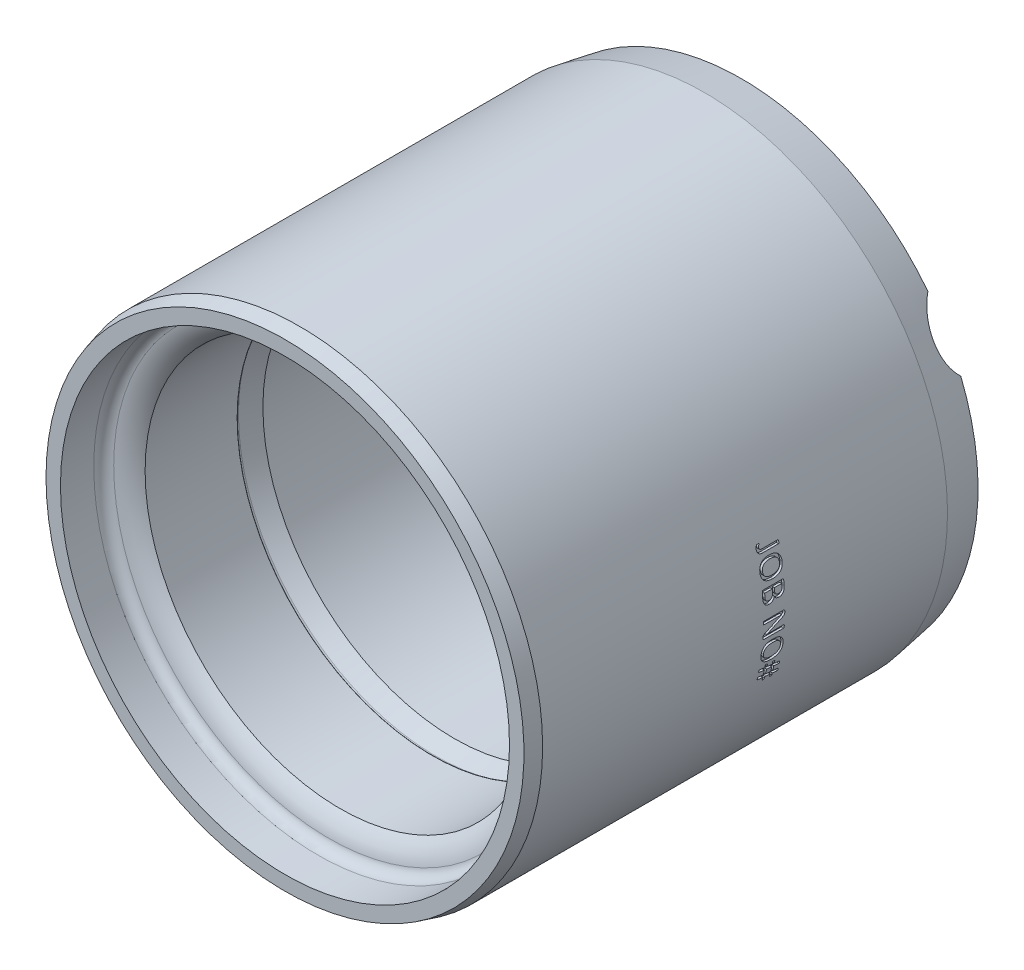
from build123d import *

# Parameters (mm, degrees)
CUT_EXTRUDE3_REACH      = 79.602
CUT_EXTRUDE3_END_RADIUS = 33
CIRPATTERN3_COUNT       = 3
CUT_EXTRUDE4_DEPTH      = 11
SKETCH11_R              = 32.7
SKETCH11_R_2            = 31.5
BOSS_EXTRUDE1_DEPTH     = 45


with BuildPart() as part:
    # Sketch1 → Revolve1 (revolve)
    with BuildSketch(Plane(origin=(0, 0, 0), x_dir=(0, 0, -1), z_dir=(1, 0, 0))):
        with BuildLine():
            Line((0, 32.15), (0, 27))
            Line((0, 27), (-0.741586391, 24.23236191))
            ThreePointArc((-0.741586391, 24.23236191), (-1.455915186, 23.163293319), (-2.673438044, 22.75))
            Line((-2.673438044, 22.75), (-4.5, 22.75))
            ThreePointArc((-4.5, 22.75), (-4.853553391, 22.896446609), (-5, 23.25))
            Line((-5, 23.25), (-5, 25.7))
            ThreePointArc((-5, 25.7), (-5.234314575, 26.265685425), (-5.8, 26.5))
            Line((-5.8, 26.5), (-6.633974596, 26.5))
            Line((-6.633974596, 26.5), (-7.5, 26))
            Line((-7.5, 26), (-39, 26))
            Line((-39, 26), (-41.469276208, 26.853868593))
            ThreePointArc((-41.469276208, 26.853868593), (-41.832067321, 26.801631143), (-42, 26.475832496))
            Line((-42, 26.475832496), (-42, 26.5))
            Line((-42, 26.5), (-54.5, 26.5))
            ThreePointArc((-54.5, 26.5), (-55.47302218, 27.761195369), (-56, 29.264418671))
            ThreePointArc((-56, 29.264418671), (-56.513865022, 30.15035386), (-57.476510334, 30.5))
            Line((-57.476510334, 30.5), (-62, 30.5))
            Line((-62, 30.5), (-62, 32.464101615))
            Line((-62, 32.464101615), (-60, 33))
            Line((-60, 33), (-5, 33))
            Line((-5, 33), (0, 32.15))
        make_face()
    revolve(axis=Axis((0, 0, 0), (0, 0, 1)))

    # Cut-Extrude3: up to this cylinder (the profile starts inside it)
    cut_extrude3_end = Plane(origin=(0, 0, 0.812657), z_dir=(0, 0, -1)) * Cylinder(CUT_EXTRUDE3_END_RADIUS, 226.204, mode=Mode.PRIVATE)
    # Sketch9 → Cut-Extrude3 (cut, up to the surface)
    with BuildSketch(Plane(origin=(0, 0, 0), x_dir=(1, 0, 0), z_dir=(0, 1, 0)), mode=Mode.PRIVATE) as cut_extrude3_sk1:
        with BuildLine():
            Line((-4.472135955, 0), (4.472135955, 0))
            ThreePointArc((4.472135955, 0), (0, -2), (-4.472135955, 0))
        make_face()
    cut_extrude3_tool1 = extrude(cut_extrude3_sk1.sketch, amount=-CUT_EXTRUDE3_REACH, mode=Mode.PRIVATE) & cut_extrude3_end
    cut_extrude3 = cut_extrude3_tool1.solids().sort_by_distance((0, 0, 0.812657))[0]
    add(cut_extrude3, mode=Mode.SUBTRACT)

    # CirPattern3: Cut-Extrude3 ×3 about axis
    cirpattern3_axis = Axis((0, 0, 0), (0, 0, -1))
    for i in range(1, CIRPATTERN3_COUNT):
        add(cut_extrude3.rotate(cirpattern3_axis, i * 360 / CIRPATTERN3_COUNT), mode=Mode.SUBTRACT)

    # Sketch10 → Cut-Extrude4 (cut)
    # profile 1 of 6: a face of its own
    with BuildSketch(Plane(origin=(40, 0, 0), x_dir=(0, 0, -1), z_dir=(1, 0, 0))):
        with BuildLine():
            add(Edge.make_bspline(
                [(-29.283076335, 7.126240809), (-29.311171742, 7.126634763), (-29.366314526, 7.127407976), (-29.447428503, 7.133226249), (-29.524776116, 7.144336515), (-29.598565322, 7.157616533), (-29.667559345, 7.177002797), (-29.731759804, 7.201785507), (-29.790829117, 7.232321092), (-29.844178879, 7.269579357), (-29.892294055, 7.312708578), (-29.934256155, 7.362396737), (-29.970999336, 7.417891533), (-30.00109765, 7.480214501), (-30.025480711, 7.549412271), (-30.041455219, 7.626567475), (-30.052679321, 7.710849177), (-30.053647129, 7.769763359), (-30.0541495, 7.800344669)],
                knots=[0, 0, 0, 0, 1.143010935, 2.243384585, 3.305342186, 4.320942577, 5.291362086, 6.215949829, 7.116473707, 7.989450952, 8.856330162, 9.737699133, 10.628119925, 11.556923371, 12.546436305, 13.604864187, 14.756727331, 16, 16, 16, 16], degree=3))
            add(Edge.make_bspline(
                [(-30.0541495, 7.800344669), (-30.053575791, 7.822237648), (-30.052433068, 7.865844391), (-30.041155349, 7.929888757), (-30.024628248, 7.990642574), (-30.004011481, 8.04681276), (-29.9803308, 8.096796264), (-29.954557497, 8.138421899), (-29.932365165, 8.170034499), (-29.91546094, 8.192399262), (-29.90016332, 8.204641592), (-29.887041835, 8.214618767), (-29.872685416, 8.223130441), (-29.855063576, 8.228804553), (-29.834473964, 8.234702567), (-29.808940381, 8.236449427), (-29.77889457, 8.238864524), (-29.757009792, 8.238983109), (-29.745185231, 8.239047181)],
                knots=[0, 0, 0, 0, 1.734681065, 3.455162098, 5.140500421, 6.72333302, 8.193997046, 9.518891422, 10.597818724, 11.263266488, 11.727288577, 12.144500434, 12.57207019, 13.041781908, 13.607748736, 14.265639715, 15.062908056, 16, 16, 16, 16], degree=3))
            add(Edge.make_bspline(
                [(-29.745185231, 8.239047181), (-29.730682536, 8.239025176), (-29.704322339, 8.238985178), (-29.668638696, 8.236221942), (-29.639713478, 8.232506118), (-29.618129836, 8.224081636), (-29.601257455, 8.215022121), (-29.591063188, 8.202188568), (-29.584146477, 8.18776799), (-29.583625337, 8.177168261), (-29.583346804, 8.171503045)],
                knots=[0, 0, 0, 0, 1.778709272, 3.232994018, 4.398029426, 5.33313715, 6.069868627, 6.71096954, 7.311054526, 8, 8, 8, 8], degree=3))
            add(Edge.make_bspline(
                [(-29.583346804, 8.171503045), (-29.584451164, 8.164412697), (-29.587099048, 8.147412425), (-29.605265857, 8.123397415), (-29.625271695, 8.092835666), (-29.648926108, 8.056949493), (-29.671343605, 8.014429874), (-29.693854643, 7.966479671), (-29.708998307, 7.909095364), (-29.710793976, 7.867766828), (-29.711747539, 7.84581993)],
                knots=[0, 0, 0, 0, 0.477542415, 1.144986375, 1.978504432, 2.958097559, 4.033814973, 5.217747953, 6.52252689, 8, 8, 8, 8], degree=3))
            add(Edge.make_bspline(
                [(-29.711747539, 7.84581993), (-29.710908787, 7.822145988), (-29.709348034, 7.778093421), (-29.696454437, 7.716042379), (-29.667299504, 7.663698115), (-29.630300064, 7.629754872), (-29.593388834, 7.607700508), (-29.559648678, 7.594454967), (-29.521992663, 7.581088881), (-29.478614412, 7.571571278), (-29.429334942, 7.563263176), (-29.373430799, 7.558493183), (-29.310762236, 7.555015731), (-29.266809532, 7.554510056), (-29.243619859, 7.55424326)],
                knots=[0, 0, 0, 0, 1.336192069, 2.486391609, 3.539509806, 4.660733814, 5.275522948, 5.957650545, 6.701467244, 7.52828585, 8.45881682, 9.520165551, 10.691626503, 12, 12, 12, 12], degree=3))
            Line((-29.243619859, 7.55424326), (-27.170482987, 7.55424326))
            add(Edge.make_bspline(
                [(-27.170482987, 7.55424326), (-27.165276473, 7.553670697), (-27.154782866, 7.55251671), (-27.139809302, 7.544590129), (-27.127055673, 7.529794879), (-27.117750001, 7.50763039), (-27.109614858, 7.478244967), (-27.104989377, 7.440444418), (-27.101604371, 7.393584033), (-27.101171345, 7.359200205), (-27.100932588, 7.340242034)],
                knots=[0, 0, 0, 0, 0.51207449, 1.032074136, 1.622280887, 2.397485073, 3.376723707, 4.617546833, 6.135020758, 8, 8, 8, 8], degree=3))
            add(Edge.make_bspline(
                [(-27.100932588, 7.340242034), (-27.101196411, 7.321734218), (-27.101683236, 7.287582174), (-27.104895638, 7.240898511), (-27.109768936, 7.202990133), (-27.117248238, 7.173696979), (-27.127868373, 7.152330524), (-27.139498534, 7.136716254), (-27.154634422, 7.12786017), (-27.165262856, 7.126774187), (-27.170482987, 7.126240809)],
                knots=[0, 0, 0, 0, 1.825144692, 3.367897259, 4.611461284, 5.592862992, 6.330205755, 6.955088943, 7.486794371, 8, 8, 8, 8], degree=3))
            Line((-27.170482987, 7.126240809), (-29.283076335, 7.126240809))
        make_face()
    # profile 2 of 6: a face of its own
    with BuildSketch(Plane(origin=(40, 0, 0), x_dir=(0, 0, -1), z_dir=(1, 0, 0))):
        with BuildLine():
            add(Edge.make_bspline(
                [(-28.52270323, 3.959022672), (-28.580026634, 3.960070836), (-28.692210562, 3.962122132), (-28.856058522, 3.97750824), (-29.011466357, 4.003440774), (-29.15774619, 4.040060251), (-29.294804362, 4.086457834), (-29.421144281, 4.144139458), (-29.53695897, 4.212086899), (-29.642767126, 4.289591231), (-29.737034579, 4.378575686), (-29.819797547, 4.477979738), (-29.890303909, 4.588350071), (-29.950302081, 4.70843402), (-29.997168619, 4.839760469), (-30.03016229, 4.981548383), (-30.050634265, 5.133649746), (-30.05295436, 5.238504439), (-30.0541495, 5.292517808)],
                knots=[0, 0, 0, 0, 1.191349841, 2.33151377, 3.416966321, 4.463182302, 5.462485, 6.420369482, 7.344547342, 8.24900213, 9.140535385, 10.032176993, 10.930546801, 11.856778172, 12.816733517, 13.821446026, 14.877770412, 16, 16, 16, 16], degree=3))
            add(Edge.make_bspline(
                [(-30.0541495, 5.292517808), (-30.05315048, 5.345636776), (-30.05121289, 5.448660566), (-30.031891962, 5.597219162), (-30.002481561, 5.735027091), (-29.95959924, 5.861634742), (-29.904200925, 5.977291115), (-29.838965379, 6.083268029), (-29.760953861, 6.177527053), (-29.672725913, 6.261993829), (-29.572839046, 6.3358453), (-29.461995999, 6.399575827), (-29.339692552, 6.452226585), (-29.206784637, 6.495808287), (-29.062740326, 6.528639935), (-28.908325136, 6.552476625), (-28.743689726, 6.567518409), (-28.630406089, 6.569050368), (-28.572191014, 6.569837623)],
                knots=[0, 0, 0, 0, 1.137667702, 2.206496874, 3.204370452, 4.15299996, 5.06318426, 5.947235594, 6.812662801, 7.677575739, 8.558407935, 9.46786496, 10.411212271, 11.406659154, 12.461056006, 13.573073946, 14.752832389, 16, 16, 16, 16], degree=3))
            add(Edge.make_bspline(
                [(-28.572191014, 6.569837623), (-28.515979412, 6.56880696), (-28.406236689, 6.566794781), (-28.24553296, 6.551185982), (-28.092757901, 6.525477125), (-27.948130858, 6.488552671), (-27.812266569, 6.442564769), (-27.686820308, 6.384583288), (-27.571973152, 6.316316269), (-27.467636715, 6.237654947), (-27.373815051, 6.149002102), (-27.291717744, 6.049199323), (-27.221145195, 5.938677327), (-27.162286662, 5.817710596), (-27.115155847, 5.686657926), (-27.081976036, 5.544881396), (-27.061703043, 5.392750677), (-27.059344654, 5.287678826), (-27.058132343, 5.233667471)],
                knots=[0, 0, 0, 0, 1.175343485, 2.294640089, 3.372947809, 4.412007972, 5.413017894, 6.368293769, 7.296489874, 8.201798854, 9.095401933, 9.989527717, 10.897317773, 11.831337077, 12.797167058, 13.803492583, 14.870902707, 16, 16, 16, 16], degree=3))
            add(Edge.make_bspline(
                [(-27.058132343, 5.233667471), (-27.059240115, 5.181677539), (-27.061391483, 5.080709529), (-27.079344438, 4.934374647), (-27.110253457, 4.798499781), (-27.152097822, 4.672782299), (-27.205856415, 4.557357764), (-27.271308099, 4.452150905), (-27.347648581, 4.356493331), (-27.436166741, 4.271779797), (-27.535407145, 4.197273775), (-27.644952847, 4.131787904), (-27.766210738, 4.077980506), (-27.897905924, 4.033875294), (-28.040063174, 3.999998626), (-28.192156775, 3.976538933), (-28.354089336, 3.961282921), (-28.465376781, 3.959791126), (-28.52270323, 3.959022672)],
                knots=[0, 0, 0, 0, 1.124153723, 2.183183562, 3.18197749, 4.133311137, 5.04347791, 5.929104716, 6.80702139, 7.683308329, 8.57135945, 9.485819096, 10.43743367, 11.434504052, 12.485735786, 13.593802196, 14.76051808, 16, 16, 16, 16], degree=3))
        make_face()
        with BuildLine():
            add(Edge.make_bspline(
                [(-28.551459645, 4.387025123), (-28.511321438, 4.387526823), (-28.432300401, 4.388514532), (-28.316005679, 4.396656988), (-28.203975631, 4.410075909), (-28.096563466, 4.428162686), (-27.994801637, 4.453532057), (-27.899293886, 4.48543342), (-27.810694715, 4.524845965), (-27.729067985, 4.571785547), (-27.655091154, 4.626624164), (-27.589400597, 4.690046634), (-27.533072819, 4.762268138), (-27.484954204, 4.842683126), (-27.446518003, 4.932511357), (-27.419387718, 5.032156022), (-27.403280476, 5.141746307), (-27.401475058, 5.218005843), (-27.400534304, 5.257742609)],
                knots=[0, 0, 0, 0, 1.16906547, 2.301566814, 3.393680675, 4.454778471, 5.47212095, 6.44540886, 7.384232912, 8.291912384, 9.18278391, 10.059847445, 10.943138162, 11.842909913, 12.782474672, 13.779662713, 14.843042763, 16, 16, 16, 16], degree=3))
            add(Edge.make_bspline(
                [(-27.400534304, 5.257742609), (-27.401643046, 5.297489766), (-27.403772479, 5.373827493), (-27.4212743, 5.483510898), (-27.450439871, 5.583247702), (-27.491733192, 5.673302196), (-27.543222478, 5.753638078), (-27.601801681, 5.826923913), (-27.668748724, 5.891881605), (-27.743799079, 5.948117316), (-27.825277206, 5.997356087), (-27.913639278, 6.038652475), (-28.008671501, 6.072206872), (-28.109588288, 6.09760356), (-28.214791761, 6.117629698), (-28.323358453, 6.13132126), (-28.434491038, 6.140530885), (-28.509532081, 6.141397372), (-28.547447122, 6.141835172)],
                knots=[0, 0, 0, 0, 1.161227874, 2.230234876, 3.23623063, 4.189578402, 5.115044591, 6.018624442, 6.926329179, 7.833285333, 8.754014825, 9.704195839, 10.678922322, 11.695036858, 12.742866953, 13.807197742, 14.89207049, 16, 16, 16, 16], degree=3))
            add(Edge.make_bspline(
                [(-28.547447122, 6.141835172), (-28.588925225, 6.14135953), (-28.670400777, 6.140425227), (-28.789973621, 6.131968045), (-28.904795576, 6.119764356), (-29.014072376, 6.101230517), (-29.117397509, 6.07659885), (-29.214125974, 6.045898477), (-29.302871734, 6.00570867), (-29.38484411, 5.959899127), (-29.459359085, 5.906522165), (-29.524142535, 5.843231675), (-29.580758701, 5.771896754), (-29.628537728, 5.691782919), (-29.666715255, 5.601968898), (-29.692745061, 5.501714096), (-29.709081905, 5.390913529), (-29.710833033, 5.313534324), (-29.711747539, 5.273123947)],
                knots=[0, 0, 0, 0, 1.197112985, 2.35149234, 3.458580793, 4.529125571, 5.548253836, 6.522942298, 7.453293408, 8.355171445, 9.230372149, 10.090421365, 10.960688115, 11.852339373, 12.774981647, 13.767684789, 14.834199703, 16, 16, 16, 16], degree=3))
            add(Edge.make_bspline(
                [(-29.711747539, 5.273123947), (-29.710627464, 5.233155124), (-29.70846967, 5.156156258), (-29.691001169, 5.045372571), (-29.6618458, 4.944300374), (-29.62062006, 4.853134771), (-29.569393331, 4.771492378), (-29.508999352, 4.699078699), (-29.442126167, 4.633200285), (-29.365779233, 4.577170459), (-29.282362712, 4.529028906), (-29.192774493, 4.488245177), (-29.09677793, 4.455510499), (-28.995421907, 4.429718256), (-28.889214095, 4.410522909), (-28.779291339, 4.397681959), (-28.666423357, 4.38828838), (-28.59004451, 4.387449105), (-28.551459645, 4.387025123)],
                knots=[0, 0, 0, 0, 1.156376524, 2.227728346, 3.236314579, 4.192133592, 5.114055089, 6.016996904, 6.915872434, 7.824329852, 8.74947427, 9.699417313, 10.668622314, 11.681101484, 12.723901887, 13.789878023, 14.883496378, 16, 16, 16, 16], degree=3))
        make_face(mode=Mode.SUBTRACT)
    # profile 3 of 6: a face of its own
    with BuildSketch(Plane(origin=(40, 0, 0), x_dir=(0, 0, -1), z_dir=(1, 0, 0))):
        with BuildLine():
            add(Edge.make_bspline(
                [(-29.190119552, 1.391007966), (-29.212209726, 1.39130739), (-29.255604876, 1.391895597), (-29.319461943, 1.399094029), (-29.380851056, 1.409265492), (-29.457661506, 1.429844593), (-29.547344429, 1.464870394), (-29.645604947, 1.521013861), (-29.731004796, 1.592662162), (-29.806412895, 1.675524095), (-29.868800475, 1.771591861), (-29.921693347, 1.877734568), (-29.960414787, 1.994210392), (-29.985767455, 2.096817654), (-29.998668231, 2.184178869), (-30.005899707, 2.255135532), (-30.010825513, 2.330761138), (-30.011171314, 2.382761709), (-30.011349255, 2.409520048)],
                knots=[0, 0, 0, 0, 0.717545398, 1.409585587, 2.086093876, 2.738028078, 3.990528374, 5.204535299, 6.398335882, 7.598625512, 8.832337766, 10.108869732, 11.442271239, 12.812862199, 13.538264167, 14.310316416, 15.130526328, 16, 16, 16, 16], degree=3))
            Line((-30.011349255, 2.409520048), (-30.011349255, 3.172568168))
            add(Edge.make_bspline(
                [(-30.011349255, 3.172568168), (-30.009573627, 3.189799195), (-30.005932504, 3.225133337), (-29.983277118, 3.265463495), (-29.956184091, 3.292637137), (-29.927759402, 3.307241087), (-29.8930575, 3.316040807), (-29.867852529, 3.316675181), (-29.854192105, 3.317018995)],
                knots=[0, 0, 0, 0, 1.283024327, 2.630984544, 3.348831971, 4.123093912, 4.982766836, 6, 6, 6, 6], degree=3))
            Line((-29.854192105, 3.317018995), (-27.258089738, 3.317018995))
            add(Edge.make_bspline(
                [(-27.258089738, 3.317018995), (-27.24442586, 3.316678773), (-27.219214515, 3.316051027), (-27.184553447, 3.307208846), (-27.155855221, 3.292670194), (-27.129155639, 3.264559429), (-27.106412367, 3.224007424), (-27.102722197, 3.188466718), (-27.100932588, 3.17123066)],
                knots=[0, 0, 0, 0, 1.012797402, 1.868721623, 2.639607306, 3.365943559, 4.722570448, 6, 6, 6, 6], degree=3))
            Line((-27.100932588, 3.17123066), (-27.100932588, 2.502476831))
            add(Edge.make_bspline(
                [(-27.100932588, 2.502476831), (-27.101571333, 2.460328167), (-27.102786354, 2.380152972), (-27.111914264, 2.265718951), (-27.127665183, 2.163299348), (-27.14964955, 2.071704026), (-27.178123928, 1.989932212), (-27.211506436, 1.915586371), (-27.251124674, 1.848249436), (-27.296603499, 1.78780054), (-27.34772571, 1.73477355), (-27.403977092, 1.688250916), (-27.466424124, 1.64995218), (-27.533669432, 1.617283565), (-27.606379399, 1.592907889), (-27.683356393, 1.574812877), (-27.765134744, 1.563832971), (-27.821145882, 1.562760315), (-27.849936878, 1.562208946)],
                knots=[0, 0, 0, 0, 1.474059348, 2.803955984, 4.011411403, 5.094932464, 6.093527403, 7.035585468, 7.94082247, 8.820276359, 9.674947962, 10.511504882, 11.366034228, 12.2308516, 13.120920121, 14.041900977, 14.993492692, 16, 16, 16, 16], degree=3))
            add(Edge.make_bspline(
                [(-27.849936878, 1.562208946), (-27.884349719, 1.563288274), (-27.952144807, 1.565414606), (-28.051023107, 1.584530745), (-28.143747136, 1.616236743), (-28.230057628, 1.658760356), (-28.308123873, 1.71436762), (-28.376630493, 1.78259037), (-28.435732373, 1.862446758), (-28.464584027, 1.922789357), (-28.479234231, 1.953429936)],
                knots=[0, 0, 0, 0, 1.048458382, 2.065517578, 3.056350007, 4.028996594, 4.98895111, 5.964561463, 6.966451261, 8, 8, 8, 8], degree=3))
            add(Edge.make_bspline(
                [(-28.479234231, 1.953429936), (-28.483322146, 1.934159624), (-28.491451037, 1.89584026), (-28.510212937, 1.840197883), (-28.53177086, 1.78564136), (-28.559507357, 1.733809996), (-28.590753853, 1.684200385), (-28.626350359, 1.637855668), (-28.666183049, 1.594895614), (-28.709386926, 1.55488343), (-28.756576302, 1.518217343), (-28.808151406, 1.486472625), (-28.863308775, 1.458100299), (-28.922147852, 1.434190975), (-28.984391098, 1.414342592), (-29.050413044, 1.4016267), (-29.119187519, 1.392239547), (-29.166233306, 1.391422699), (-29.190119552, 1.391007966)],
                knots=[0, 0, 0, 0, 0.957116368, 1.903243099, 2.851354886, 3.806566421, 4.756844616, 5.699985928, 6.643563201, 7.602458084, 8.560801368, 9.544377285, 10.543069153, 11.57372351, 12.629718687, 13.713934332, 14.839311029, 16, 16, 16, 16], degree=3))
        make_face()
        with BuildLine():
            add(Edge.make_bspline(
                [(-27.8800308, 1.990211397), (-27.844942847, 1.991359426), (-27.777655411, 1.993560977), (-27.69633853, 2.010891538), (-27.638108193, 2.03303823), (-27.597541953, 2.051810454), (-27.561516547, 2.076532959), (-27.527986858, 2.103960281), (-27.498713891, 2.136459483), (-27.472197774, 2.172724208), (-27.450188781, 2.213976386), (-27.431861833, 2.260140574), (-27.418012259, 2.312699202), (-27.407264922, 2.372132838), (-27.401586668, 2.439504604), (-27.400897671, 2.486863151), (-27.400534304, 2.511839384)],
                knots=[0, 0, 0, 0, 1.801750381, 3.455179152, 4.238008704, 5.00124002, 5.744532905, 6.476265321, 7.222024699, 7.984912217, 8.779219113, 9.617161995, 10.53124474, 11.566894225, 12.716814158, 14, 14, 14, 14], degree=3))
            Line((-27.400534304, 2.511839384), (-27.400534304, 2.889016544))
            Line((-27.400534304, 2.889016544), (-28.384939941, 2.889016544))
            Line((-28.384939941, 2.889016544), (-28.384939941, 2.473720416))
            add(Edge.make_bspline(
                [(-28.384939941, 2.473720416), (-28.384415829, 2.451185435), (-28.383416433, 2.40821488), (-28.376245582, 2.347012249), (-28.363942679, 2.292548483), (-28.345669255, 2.244656671), (-28.32203, 2.203078212), (-28.297060814, 2.164281547), (-28.267069023, 2.130200518), (-28.223434413, 2.088739226), (-28.15868157, 2.047071707), (-28.071105797, 2.013517031), (-27.976940366, 1.994301916), (-27.912437522, 1.991579273), (-27.8800308, 1.990211397)],
                knots=[0, 0, 0, 0, 1.020345009, 1.945632491, 2.785481367, 3.54283894, 4.25662876, 4.948158123, 5.628096787, 6.306535143, 7.67004186, 9.079699953, 10.532818958, 12, 12, 12, 12], degree=3))
        make_face(mode=Mode.SUBTRACT)
        with BuildLine():
            add(Edge.make_bspline(
                [(-29.218207213, 1.819010417), (-29.197004263, 1.819524005), (-29.15602536, 1.820516615), (-29.096529774, 1.828162806), (-29.04080739, 1.839759806), (-28.98910893, 1.857379825), (-28.941197572, 1.879351771), (-28.897609017, 1.906604157), (-28.857025611, 1.936992768), (-28.82137946, 1.973252181), (-28.789119633, 2.0134386), (-28.760636418, 2.058570012), (-28.737730781, 2.108980577), (-28.717845607, 2.164115287), (-28.70245661, 2.225458989), (-28.6923418, 2.293777637), (-28.685318004, 2.369249354), (-28.684808759, 2.421985054), (-28.684541657, 2.449645278)],
                knots=[0, 0, 0, 0, 1.076338185, 2.080236849, 3.041624367, 3.96160127, 4.847880865, 5.711830604, 6.567658865, 7.41611888, 8.285907433, 9.181034578, 10.117918527, 11.091820069, 12.154318916, 13.323062166, 14.595928373, 16, 16, 16, 16], degree=3))
            Line((-28.684541657, 2.449645278), (-28.684541657, 2.889016544))
            Line((-28.684541657, 2.889016544), (-29.711747539, 2.889016544))
            Line((-29.711747539, 2.889016544), (-29.711747539, 2.356019742))
            add(Edge.make_bspline(
                [(-29.711747539, 2.356019742), (-29.71141251, 2.335713643), (-29.710762963, 2.29634464), (-29.704344509, 2.239419635), (-29.69561243, 2.186180499), (-29.676729679, 2.121727726), (-29.644086901, 2.047573222), (-29.597963614, 1.982387146), (-29.554790321, 1.936519154), (-29.517011042, 1.90715859), (-29.476720622, 1.880213208), (-29.432024565, 1.857967338), (-29.383716761, 1.840751607), (-29.331796386, 1.827822788), (-29.276142951, 1.82065422), (-29.237843467, 1.819567554), (-29.218207213, 1.819010417)],
                knots=[0, 0, 0, 0, 1.033364579, 2.003463763, 2.914043665, 3.776156701, 5.417129535, 7.013579487, 7.816270035, 8.615664099, 9.443554668, 10.281036217, 11.149846822, 12.049969344, 13.000213735, 14, 14, 14, 14], degree=3))
        make_face(mode=Mode.SUBTRACT)
    # profile 4 of 6: a face of its own
    with BuildSketch(Plane(origin=(40, 0, 0), x_dir=(0, 0, -1), z_dir=(1, 0, 0))):
        with BuildLine():
            add(Edge.make_bspline(
                [(-29.845498305, -2.461014093), (-29.859433167, -2.460390485), (-29.885678217, -2.459215975), (-29.921659496, -2.446607787), (-29.950861468, -2.427565993), (-29.974081296, -2.40356491), (-29.991665269, -2.375718138), (-30.003579494, -2.344779803), (-30.010201266, -2.312391152), (-30.010971608, -2.290509107), (-30.011349255, -2.279781805)],
                knots=[0, 0, 0, 0, 1.205195523, 2.269876715, 3.262688849, 4.206796125, 5.146133144, 6.101866096, 7.069471963, 8, 8, 8, 8], degree=3))
            Line((-30.011349255, -2.279781805), (-30.011349255, -2.143356024))
            add(Edge.make_bspline(
                [(-30.011349255, -2.143356024), (-30.010718408, -2.123039412), (-30.00953902, -2.085056926), (-30.000500295, -2.030612234), (-29.981847748, -1.981442396), (-29.952668799, -1.935431978), (-29.911822771, -1.891624264), (-29.859390526, -1.847729349), (-29.793091219, -1.80424187), (-29.742783032, -1.778174599), (-29.715760062, -1.764172603)],
                knots=[0, 0, 0, 0, 0.949295484, 1.774735033, 2.565947931, 3.389611136, 4.303976894, 5.353577399, 6.578477978, 8, 8, 8, 8], degree=3))
            Line((-29.715760062, -1.764172603), (-28.067950626, -0.921542777))
            add(Edge.make_bspline(
                [(-28.067950626, -0.921542777), (-28.024310963, -0.899369402), (-27.935519666, -0.854254417), (-27.800496995, -0.788106215), (-27.664460445, -0.723710406), (-27.573157088, -0.683281392), (-27.528266286, -0.663403799)],
                knots=[0, 0, 0, 0, 0.981709107, 1.997431203, 3.015403985, 4, 4, 4, 4], degree=3))
            Line((-27.528266286, -0.663403799), (-27.528266286, -0.658722522))
            add(Edge.make_bspline(
                [(-27.528266286, -0.658722522), (-27.582432896, -0.659986352), (-27.692093607, -0.662544985), (-27.857514925, -0.663636212), (-28.024258553, -0.663345871), (-28.135494711, -0.663384515), (-28.191001331, -0.663403799)],
                knots=[0, 0, 0, 0, 0.98097619, 1.98599371, 2.995014897, 4, 4, 4, 4], degree=3))
            Line((-28.191001331, -0.663403799), (-29.939792595, -0.663403799))
            add(Edge.make_bspline(
                [(-29.939792595, -0.663403799), (-29.944983477, -0.662798402), (-29.955643519, -0.661555152), (-29.971317119, -0.653816095), (-29.984319161, -0.638518923), (-29.994370437, -0.616147446), (-29.9995684, -0.586079881), (-30.007362048, -0.548927519), (-30.01067192, -0.501834799), (-30.011107793, -0.467233385), (-30.011349255, -0.448065066)],
                knots=[0, 0, 0, 0, 0.507629026, 1.042471493, 1.658265389, 2.426739807, 3.40789359, 4.62344465, 6.12947268, 8, 8, 8, 8], degree=3))
            add(Edge.make_bspline(
                [(-30.011349255, -0.448065066), (-30.011117231, -0.428893862), (-30.010698395, -0.394287242), (-30.007286217, -0.347225789), (-29.999904543, -0.310625481), (-29.994106064, -0.281628843), (-29.984423134, -0.260071342), (-29.970896238, -0.245804771), (-29.955847191, -0.237090738), (-29.945016236, -0.23595102), (-29.939792595, -0.235401348)],
                knots=[0, 0, 0, 0, 1.891572084, 3.414544002, 4.643770878, 5.571751689, 6.329019298, 6.93561505, 7.486659786, 8, 8, 8, 8], degree=3))
            Line((-29.939792595, -0.235401348), (-27.266783538, -0.235401348))
            add(Edge.make_bspline(
                [(-27.266783538, -0.235401348), (-27.252901027, -0.235973244), (-27.226724989, -0.237051577), (-27.19027244, -0.246860126), (-27.160238193, -0.264628399), (-27.138133505, -0.28965247), (-27.12186064, -0.317750865), (-27.109471932, -0.347143566), (-27.102717944, -0.37821728), (-27.10153635, -0.399216216), (-27.100932588, -0.409946098)],
                knots=[0, 0, 0, 0, 1.222480005, 2.305035548, 3.292617378, 4.252430297, 5.213047754, 6.147369849, 7.053356642, 8, 8, 8, 8], degree=3))
            Line((-27.100932588, -0.409946098), (-27.100932588, -0.613916016))
            add(Edge.make_bspline(
                [(-27.100932588, -0.613916016), (-27.101287197, -0.6360183), (-27.101938947, -0.676641051), (-27.110425214, -0.73273548), (-27.12548051, -0.780883845), (-27.148689142, -0.823128131), (-27.18113389, -0.861771875), (-27.222494029, -0.898727435), (-27.275130586, -0.934373466), (-27.314928857, -0.955601021), (-27.336333936, -0.967018038)],
                knots=[0, 0, 0, 0, 1.163684759, 2.138786855, 2.978191552, 3.808674946, 4.659829269, 5.624477827, 6.722350489, 8, 8, 8, 8], degree=3))
            Line((-27.336333936, -0.967018038), (-28.607634967, -1.613702991))
            add(Edge.make_bspline(
                [(-28.607634967, -1.613702991), (-28.645993698, -1.633063093), (-28.721821188, -1.671334118), (-28.833935251, -1.72865383), (-28.944660345, -1.782507842), (-29.052933795, -1.835470576), (-29.159589016, -1.886981749), (-29.264738335, -1.937946573), (-29.369348438, -1.988444787), (-29.43931094, -2.021261946), (-29.47433993, -2.037692919)],
                knots=[0, 0, 0, 0, 1.068742979, 2.112689677, 3.13185519, 4.131205534, 5.110747879, 6.077892953, 7.037634914, 8, 8, 8, 8], degree=3))
            Line((-29.47433993, -2.037692919), (-29.47433993, -2.03969918))
            add(Edge.make_bspline(
                [(-29.47433993, -2.03969918), (-29.414376714, -2.038467856), (-29.292005454, -2.035955003), (-29.107195852, -2.034362979), (-28.922397886, -2.032689262), (-28.800013543, -2.032905628), (-28.740048225, -2.033011642)],
                knots=[0, 0, 0, 0, 0.980070645, 2.000100891, 3.020098614, 4, 4, 4, 4], degree=3))
            Line((-28.740048225, -2.033011642), (-27.172489248, -2.033011642))
            add(Edge.make_bspline(
                [(-27.172489248, -2.033011642), (-27.167253488, -2.03353173), (-27.156593231, -2.034590654), (-27.141737818, -2.043654983), (-27.128543108, -2.058567772), (-27.118348917, -2.080881977), (-27.109503332, -2.110025846), (-27.104960292, -2.147930922), (-27.101560306, -2.195673116), (-27.101157712, -2.231173924), (-27.100932588, -2.251025391)],
                knots=[0, 0, 0, 0, 0.502953326, 1.024036879, 1.634158783, 2.404945848, 3.372755644, 4.570153255, 6.082086269, 8, 8, 8, 8], degree=3))
            add(Edge.make_bspline(
                [(-27.100932588, -2.251025391), (-27.101180731, -2.268870893), (-27.101643391, -2.30214368), (-27.105124866, -2.347857638), (-27.109255602, -2.385885492), (-27.11873103, -2.41483842), (-27.129619642, -2.436290278), (-27.14218708, -2.451203811), (-27.157261206, -2.459173914), (-27.16751307, -2.460412764), (-27.172489248, -2.461014093)],
                knots=[0, 0, 0, 0, 1.781386541, 3.321379914, 4.580616967, 5.587268504, 6.344121305, 6.974526363, 7.50224285, 8, 8, 8, 8], degree=3))
            Line((-27.172489248, -2.461014093), (-29.845498305, -2.461014093))
        make_face()
    # profile 5 of 6: a face of its own
    with BuildSketch(Plane(origin=(40, 0, 0), x_dir=(0, 0, -1), z_dir=(1, 0, 0))):
        with BuildLine():
            add(Edge.make_bspline(
                [(-28.52270323, -5.671032475), (-28.580026634, -5.669984311), (-28.692210562, -5.667933015), (-28.856058522, -5.652546907), (-29.011466357, -5.626614373), (-29.15774619, -5.589994896), (-29.294804362, -5.543597313), (-29.421144281, -5.485915689), (-29.53695897, -5.417968248), (-29.642767126, -5.340463916), (-29.737034579, -5.251479461), (-29.819797547, -5.15207541), (-29.890303909, -5.041705076), (-29.950302081, -4.921621127), (-29.997168619, -4.790294678), (-30.03016229, -4.648506764), (-30.050634265, -4.496405401), (-30.05295436, -4.391550708), (-30.0541495, -4.337537339)],
                knots=[0, 0, 0, 0, 1.191349841, 2.33151377, 3.416966321, 4.463182302, 5.462485, 6.420369482, 7.344547342, 8.24900213, 9.140535385, 10.032176993, 10.930546801, 11.856778172, 12.816733517, 13.821446026, 14.877770412, 16, 16, 16, 16], degree=3))
            add(Edge.make_bspline(
                [(-30.0541495, -4.337537339), (-30.05315048, -4.284418371), (-30.05121289, -4.181394581), (-30.031891962, -4.032835985), (-30.002481561, -3.895028057), (-29.95959924, -3.768420405), (-29.904200925, -3.652764032), (-29.838965379, -3.546787118), (-29.760953861, -3.452528094), (-29.672725913, -3.368061318), (-29.572839046, -3.294209847), (-29.461995999, -3.23047932), (-29.339692552, -3.177828562), (-29.206784637, -3.13424686), (-29.062740326, -3.101415212), (-28.908325136, -3.077578522), (-28.743689726, -3.062536738), (-28.630406089, -3.061004779), (-28.572191014, -3.060217525)],
                knots=[0, 0, 0, 0, 1.137667702, 2.206496874, 3.204370452, 4.15299996, 5.06318426, 5.947235594, 6.812662801, 7.677575739, 8.558407935, 9.46786496, 10.411212271, 11.406659154, 12.461056006, 13.573073946, 14.752832389, 16, 16, 16, 16], degree=3))
            add(Edge.make_bspline(
                [(-28.572191014, -3.060217525), (-28.515979412, -3.061248187), (-28.406236689, -3.063260366), (-28.24553296, -3.078869165), (-28.092757901, -3.104578022), (-27.948130858, -3.141502476), (-27.812266569, -3.187490378), (-27.686820308, -3.245471859), (-27.571973152, -3.313738878), (-27.467636715, -3.3924002), (-27.373815051, -3.481053045), (-27.291717744, -3.580855825), (-27.221145195, -3.69137782), (-27.162286662, -3.812344551), (-27.115155847, -3.943397221), (-27.081976036, -4.085173751), (-27.061703043, -4.23730447), (-27.059344654, -4.342376321), (-27.058132343, -4.396387676)],
                knots=[0, 0, 0, 0, 1.175343485, 2.294640089, 3.372947809, 4.412007972, 5.413017894, 6.368293769, 7.296489874, 8.201798854, 9.095401933, 9.989527717, 10.897317773, 11.831337077, 12.797167058, 13.803492583, 14.870902707, 16, 16, 16, 16], degree=3))
            add(Edge.make_bspline(
                [(-27.058132343, -4.396387676), (-27.059240115, -4.448377608), (-27.061391483, -4.549345618), (-27.079344438, -4.6956805), (-27.110253457, -4.831555366), (-27.152097822, -4.957272848), (-27.205856415, -5.072697383), (-27.271308099, -5.177904242), (-27.347648581, -5.273561816), (-27.436166741, -5.35827535), (-27.535407145, -5.432781372), (-27.644952847, -5.498267243), (-27.766210738, -5.552074641), (-27.897905924, -5.596179853), (-28.040063174, -5.630056521), (-28.192156775, -5.653516214), (-28.354089336, -5.668772226), (-28.465376781, -5.670264021), (-28.52270323, -5.671032475)],
                knots=[0, 0, 0, 0, 1.124153723, 2.183183562, 3.18197749, 4.133311137, 5.04347791, 5.929104716, 6.80702139, 7.683308329, 8.57135945, 9.485819096, 10.43743367, 11.434504052, 12.485735786, 13.593802196, 14.76051808, 16, 16, 16, 16], degree=3))
        make_face()
        with BuildLine():
            add(Edge.make_bspline(
                [(-28.551459645, -5.243030025), (-28.511321438, -5.242528324), (-28.432300401, -5.241540615), (-28.316005679, -5.233398159), (-28.203975631, -5.219979238), (-28.096563466, -5.201892461), (-27.994801637, -5.17652309), (-27.899293886, -5.144621727), (-27.810694715, -5.105209182), (-27.729067985, -5.0582696), (-27.655091154, -5.003430983), (-27.589400597, -4.940008513), (-27.533072819, -4.867787009), (-27.484954204, -4.787372021), (-27.446518003, -4.69754379), (-27.419387718, -4.597899125), (-27.403280476, -4.48830884), (-27.401475058, -4.412049304), (-27.400534304, -4.372312538)],
                knots=[0, 0, 0, 0, 1.16906547, 2.301566814, 3.393680675, 4.454778471, 5.47212095, 6.44540886, 7.384232912, 8.291912384, 9.18278391, 10.059847445, 10.943138162, 11.842909913, 12.782474672, 13.779662713, 14.843042763, 16, 16, 16, 16], degree=3))
            add(Edge.make_bspline(
                [(-27.400534304, -4.372312538), (-27.401643046, -4.332565381), (-27.403772479, -4.256227654), (-27.4212743, -4.146544249), (-27.450439871, -4.046807446), (-27.491733192, -3.956752951), (-27.543222478, -3.876417069), (-27.601801681, -3.803131234), (-27.668748724, -3.738173542), (-27.743799079, -3.681937831), (-27.825277206, -3.632699061), (-27.913639278, -3.591402672), (-28.008671501, -3.557848275), (-28.109588288, -3.532451587), (-28.214791761, -3.512425449), (-28.323358453, -3.498733888), (-28.434491038, -3.489524262), (-28.509532081, -3.488657775), (-28.547447122, -3.488219975)],
                knots=[0, 0, 0, 0, 1.161227874, 2.230234876, 3.23623063, 4.189578402, 5.115044591, 6.018624442, 6.926329179, 7.833285333, 8.754014825, 9.704195839, 10.678922322, 11.695036858, 12.742866953, 13.807197742, 14.89207049, 16, 16, 16, 16], degree=3))
            add(Edge.make_bspline(
                [(-28.547447122, -3.488219975), (-28.588925225, -3.488695617), (-28.670400777, -3.48962992), (-28.789973621, -3.498087102), (-28.904795576, -3.510290791), (-29.014072376, -3.52882463), (-29.117397509, -3.553456297), (-29.214125974, -3.58415667), (-29.302871734, -3.624346477), (-29.38484411, -3.67015602), (-29.459359085, -3.723532982), (-29.524142535, -3.786823472), (-29.580758701, -3.858158393), (-29.628537728, -3.938272228), (-29.666715255, -4.028086249), (-29.692745061, -4.128341051), (-29.709081905, -4.239141618), (-29.710833033, -4.316520823), (-29.711747539, -4.3569312)],
                knots=[0, 0, 0, 0, 1.197112985, 2.35149234, 3.458580793, 4.529125571, 5.548253836, 6.522942298, 7.453293408, 8.355171445, 9.230372149, 10.090421365, 10.960688115, 11.852339373, 12.774981647, 13.767684789, 14.834199703, 16, 16, 16, 16], degree=3))
            add(Edge.make_bspline(
                [(-29.711747539, -4.3569312), (-29.710627464, -4.396900023), (-29.70846967, -4.473898889), (-29.691001169, -4.584682576), (-29.6618458, -4.685754773), (-29.62062006, -4.776920377), (-29.569393331, -4.858562769), (-29.508999352, -4.930976448), (-29.442126167, -4.996854863), (-29.365779233, -5.052884688), (-29.282362712, -5.101026241), (-29.192774493, -5.14180997), (-29.09677793, -5.174544648), (-28.995421907, -5.200336891), (-28.889214095, -5.219532238), (-28.779291339, -5.232373188), (-28.666423357, -5.241766767), (-28.59004451, -5.242606042), (-28.551459645, -5.243030025)],
                knots=[0, 0, 0, 0, 1.156376524, 2.227728346, 3.236314579, 4.192133592, 5.114055089, 6.016996904, 6.915872434, 7.824329852, 8.74947427, 9.699417313, 10.668622314, 11.681101484, 12.723901887, 13.789878023, 14.883496378, 16, 16, 16, 16], degree=3))
        make_face(mode=Mode.SUBTRACT)
    # profile 6 of 6: a face of its own
    with BuildSketch(Plane(origin=(40, 0, 0), x_dir=(0, 0, -1), z_dir=(1, 0, 0))):
        with BuildLine():
            add(Edge.make_bspline(
                [(-28.022475366, -8.146759153), (-28.034733932, -8.146494525), (-28.057546041, -8.146002076), (-28.089197249, -8.142709685), (-28.114893703, -8.134688784), (-28.136302121, -8.126773161), (-28.152239404, -8.11499001), (-28.163587834, -8.101271061), (-28.169617064, -8.08569036), (-28.170507482, -8.075020116), (-28.170938716, -8.069852462)],
                knots=[0, 0, 0, 0, 1.585493505, 2.950463181, 4.090114511, 5.058512887, 5.8824451, 6.620292838, 7.331800774, 8, 8, 8, 8], degree=3))
            Line((-28.170938716, -8.069852462), (-28.170938716, -7.77426327))
            Line((-28.170938716, -7.77426327), (-28.898542883, -7.683981503))
            Line((-28.898542883, -7.683981503), (-28.898542883, -7.94546425))
            add(Edge.make_bspline(
                [(-28.898542883, -7.94546425), (-28.900326626, -7.95628467), (-28.904143638, -7.97943915), (-28.929625671, -7.999928779), (-28.955746288, -8.01147149), (-28.982292909, -8.017861841), (-29.014112984, -8.021781493), (-29.037181673, -8.022163794), (-29.049681248, -8.022370941)],
                knots=[0, 0, 0, 0, 1.024381265, 2.192060678, 2.920989636, 3.783789429, 4.799164969, 6, 6, 6, 6], degree=3))
            add(Edge.make_bspline(
                [(-29.049681248, -8.022370941), (-29.061947734, -8.021906215), (-29.084796382, -8.021040575), (-29.116368374, -8.01689863), (-29.141968514, -8.008830173), (-29.163390936, -8.001697229), (-29.179621221, -7.990611791), (-29.190770984, -7.976855376), (-29.196828147, -7.961308433), (-29.197715061, -7.950633954), (-29.198144598, -7.94546425)],
                knots=[0, 0, 0, 0, 1.59123886, 2.963982869, 4.106821096, 5.067125073, 5.876523612, 6.616434653, 7.329932235, 8, 8, 8, 8], degree=3))
            Line((-29.198144598, -7.94546425), (-29.198144598, -7.645193781))
            Line((-29.198144598, -7.645193781), (-29.949823903, -7.550899491))
            add(Edge.make_bspline(
                [(-29.949823903, -7.550899491), (-29.954742151, -7.549654076), (-29.964106746, -7.547282742), (-29.977829051, -7.542258208), (-29.989379075, -7.531684303), (-29.998837607, -7.515865741), (-30.003963322, -7.493350801), (-30.008939661, -7.464615502), (-30.011183861, -7.427204708), (-30.011289925, -7.399312975), (-30.011349255, -7.383711033)],
                knots=[0, 0, 0, 0, 0.623518503, 1.18721085, 1.768533027, 2.504768395, 3.413694994, 4.577945876, 6.085788042, 8, 8, 8, 8], degree=3))
            add(Edge.make_bspline(
                [(-30.011349255, -7.383711033), (-30.011292692, -7.367885123), (-30.011190612, -7.339323921), (-30.008849156, -7.300595855), (-30.004044986, -7.270508295), (-29.998976681, -7.247061627), (-29.989356429, -7.231044703), (-29.977945253, -7.220575035), (-29.964242634, -7.215429189), (-29.954761174, -7.216148178), (-29.949823903, -7.216522576)],
                knots=[0, 0, 0, 0, 1.90413192, 3.436408647, 4.657645746, 5.574897484, 6.296943068, 6.867061169, 7.410045805, 8, 8, 8, 8], degree=3))
            Line((-29.949823903, -7.216522576), (-29.198144598, -7.31148562))
            Line((-29.198144598, -7.31148562), (-29.198144598, -6.684194527))
            Line((-29.198144598, -6.684194527), (-29.949823903, -6.589231484))
            add(Edge.make_bspline(
                [(-29.949823903, -6.589231484), (-29.954732329, -6.587716564), (-29.964023773, -6.584848885), (-29.977631282, -6.579908504), (-29.989189021, -6.570235147), (-29.999046757, -6.555478692), (-30.003917286, -6.533664403), (-30.009018895, -6.505422907), (-30.011159652, -6.468204264), (-30.011281241, -6.44031731), (-30.011349255, -6.424718042)],
                knots=[0, 0, 0, 0, 0.640005551, 1.211503401, 1.783001251, 2.482665773, 3.377523506, 4.530560357, 6.059281761, 8, 8, 8, 8], degree=3))
            add(Edge.make_bspline(
                [(-30.011349255, -6.424718042), (-30.011295887, -6.408224033), (-30.011200594, -6.378772764), (-30.008891853, -6.339146968), (-30.004043635, -6.308840314), (-29.998976925, -6.285393616), (-29.989356384, -6.269376697), (-29.977945263, -6.258907028), (-29.964242631, -6.253761182), (-29.954761174, -6.254480171), (-29.949823903, -6.254854569)],
                knots=[0, 0, 0, 0, 1.958332841, 3.496747774, 4.701837857, 5.606961829, 6.319460634, 6.882040718, 7.417846092, 8, 8, 8, 8], degree=3))
            Line((-29.949823903, -6.254854569), (-29.198144598, -6.347811351))
            Line((-29.198144598, -6.347811351), (-29.198144598, -6.08565985))
            add(Edge.make_bspline(
                [(-29.198144598, -6.08565985), (-29.196358327, -6.07484863), (-29.192616008, -6.052198632), (-29.168159667, -6.031819974), (-29.142967617, -6.020306643), (-29.116865393, -6.013854355), (-29.085246193, -6.010027782), (-29.062179656, -6.009634831), (-29.049681248, -6.009421913)],
                knots=[0, 0, 0, 0, 1.039304364, 2.177389968, 2.897178505, 3.751503862, 4.781671306, 6, 6, 6, 6], degree=3))
            add(Edge.make_bspline(
                [(-29.049681248, -6.009421913), (-29.037159376, -6.009446873), (-29.014203939, -6.00949263), (-28.982734271, -6.015473616), (-28.956820529, -6.022294628), (-28.936047564, -6.031355699), (-28.919360272, -6.041024397), (-28.907353145, -6.053725557), (-28.899293611, -6.06877468), (-28.89879507, -6.079987712), (-28.898542883, -6.08565985)],
                knots=[0, 0, 0, 0, 1.608025202, 2.94787549, 4.110701141, 5.048947483, 5.861112511, 6.571602993, 7.277442096, 8, 8, 8, 8], degree=3))
            Line((-28.898542883, -6.08565985), (-28.898542883, -6.388605335))
            Line((-28.898542883, -6.388605335), (-28.170938716, -6.480893363))
            Line((-28.170938716, -6.480893363), (-28.170938716, -6.208041801))
            add(Edge.make_bspline(
                [(-28.170938716, -6.208041801), (-28.169159932, -6.197211708), (-28.165353534, -6.174036528), (-28.139965262, -6.153832006), (-28.114446463, -6.141987641), (-28.088742186, -6.135718538), (-28.058275255, -6.131725846), (-28.03631429, -6.131341953), (-28.024481627, -6.13113511)],
                knots=[0, 0, 0, 0, 1.050102259, 2.247100714, 2.974367523, 3.837568928, 4.834872758, 6, 6, 6, 6], degree=3))
            add(Edge.make_bspline(
                [(-28.024481627, -6.13113511), (-28.011762106, -6.131363477), (-27.988033365, -6.131789503), (-27.955515733, -6.135506423), (-27.928541268, -6.142041235), (-27.902419425, -6.153574463), (-27.876937848, -6.174067617), (-27.873120774, -6.197221609), (-27.871337, -6.208041801)],
                knots=[0, 0, 0, 0, 1.209362666, 2.256111029, 3.109812507, 3.831054833, 4.986420944, 6, 6, 6, 6], degree=3))
            Line((-27.871337, -6.208041801), (-27.871337, -6.514999809))
            Line((-27.871337, -6.514999809), (-27.164464202, -6.607287837))
            add(Edge.make_bspline(
                [(-27.164464202, -6.607287837), (-27.159480867, -6.608138553), (-27.149754984, -6.609798879), (-27.136400191, -6.616877299), (-27.124778275, -6.628456075), (-27.1166543, -6.646204439), (-27.108914182, -6.669387659), (-27.105180714, -6.700176509), (-27.101514921, -6.73871801), (-27.101140151, -6.767325926), (-27.100932588, -6.783170094)],
                knots=[0, 0, 0, 0, 0.593007603, 1.157361895, 1.752114497, 2.4927621, 3.432045871, 4.629077832, 6.133053145, 8, 8, 8, 8], degree=3))
            add(Edge.make_bspline(
                [(-27.100932588, -6.783170094), (-27.101140744, -6.799456708), (-27.101509155, -6.828282158), (-27.104948505, -6.866214785), (-27.109079883, -6.895140794), (-27.116169517, -6.916023929), (-27.125044117, -6.93089667), (-27.136398535, -6.939743722), (-27.149386998, -6.942713463), (-27.157996018, -6.943344142), (-27.162457941, -6.943671013)],
                knots=[0, 0, 0, 0, 2.04006921, 3.610690057, 4.772625933, 5.691535429, 6.357905131, 6.916618554, 7.438499959, 8, 8, 8, 8], degree=3))
            Line((-27.162457941, -6.943671013), (-27.871337, -6.84870797))
            Line((-27.871337, -6.84870797), (-27.871337, -7.475999062))
            Line((-27.871337, -7.475999062), (-27.164464202, -7.564274567))
            add(Edge.make_bspline(
                [(-27.164464202, -7.564274567), (-27.159462303, -7.565343733), (-27.149644734, -7.567442259), (-27.136563964, -7.575270895), (-27.124942905, -7.58661738), (-27.116597115, -7.603812053), (-27.108830547, -7.626572251), (-27.105163575, -7.657388448), (-27.101479239, -7.69681764), (-27.101128773, -7.726318008), (-27.100932588, -7.74283184)],
                knots=[0, 0, 0, 0, 0.593747634, 1.16538912, 1.754551761, 2.465238737, 3.370956542, 4.556737839, 6.072517253, 8, 8, 8, 8], degree=3))
            add(Edge.make_bspline(
                [(-27.100932588, -7.74283184), (-27.101142713, -7.758449795), (-27.101521538, -7.786606701), (-27.105122582, -7.824300145), (-27.108843213, -7.853481176), (-27.116033027, -7.874515236), (-27.125483073, -7.888583475), (-27.136154212, -7.898072265), (-27.149377857, -7.901328843), (-27.157999952, -7.900886469), (-27.162457941, -7.900657744)],
                knots=[0, 0, 0, 0, 1.9720158, 3.555258182, 4.782085007, 5.681889237, 6.330184867, 6.910721493, 7.436796746, 8, 8, 8, 8], degree=3))
            Line((-27.162457941, -7.900657744), (-27.871337, -7.810375977))
            Line((-27.871337, -7.810375977), (-27.871337, -8.069852462))
            add(Edge.make_bspline(
                [(-27.871337, -8.069852462), (-27.871604, -8.075307496), (-27.872142527, -8.086310028), (-27.880512124, -8.101261652), (-27.891971621, -8.115114055), (-27.908747482, -8.126404432), (-27.929910472, -8.135917987), (-27.956199613, -8.142161562), (-27.987573914, -8.14619544), (-28.01019862, -8.146560864), (-28.022475366, -8.146759153)],
                knots=[0, 0, 0, 0, 0.69069159, 1.39309065, 2.142666949, 2.982541242, 3.953884912, 5.103619885, 6.428349875, 8, 8, 8, 8], degree=3))
        make_face()
        Polygon((-28.170938716, -6.812595263), (-28.898542883, -6.722313496), (-28.898542883, -7.347598326), (-28.170938716, -7.44256137), align=None, mode=Mode.SUBTRACT)
    extrude(amount=-CUT_EXTRUDE4_DEPTH, mode=Mode.SUBTRACT)

    # Sketch11 → Boss-Extrude1 (add)
    with BuildSketch(Plane.XY.offset(60)):
        Circle(SKETCH11_R)
        Circle(SKETCH11_R_2, mode=Mode.SUBTRACT)
    extrude(amount=-BOSS_EXTRUDE1_DEPTH)


solid = part.part
